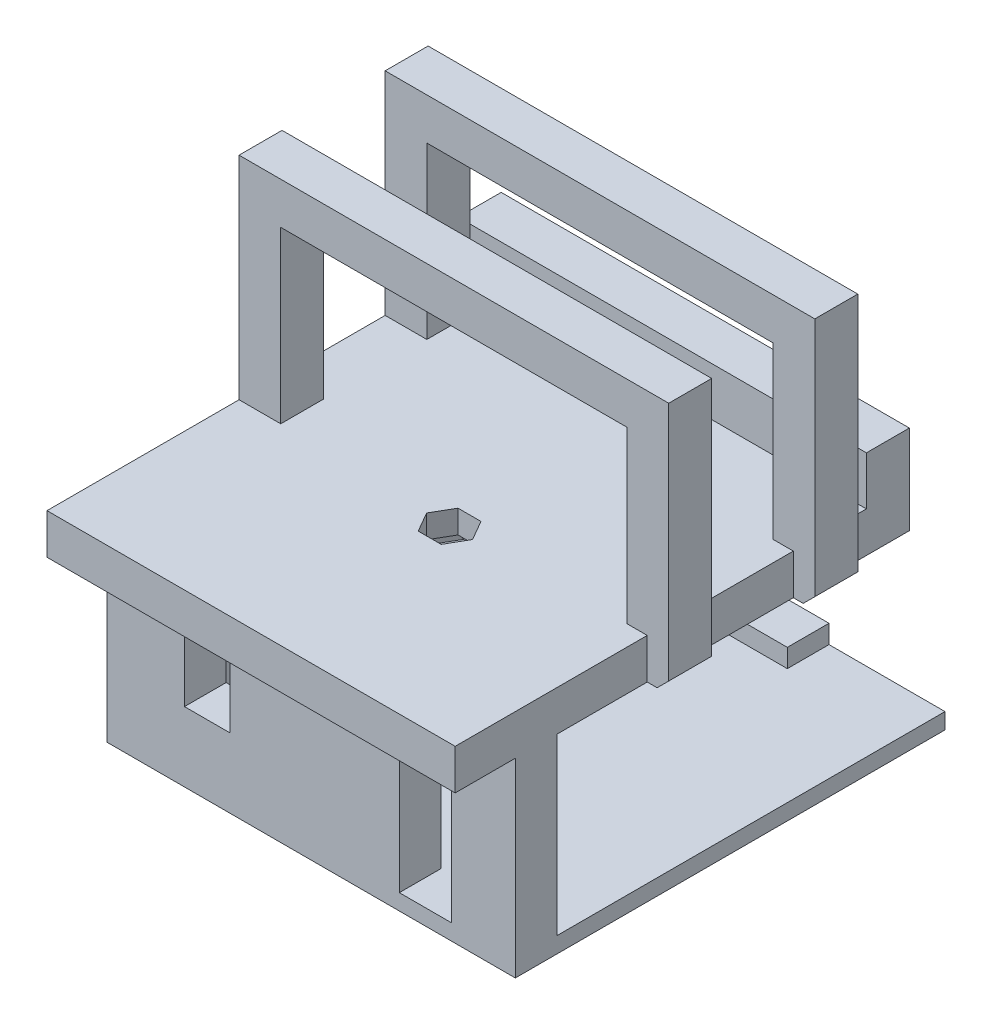
from build123d import *

# Parameters (mm, degrees)
MAIN_BODY_EXTRUDE_DEPTH            = 25
SKETCH2_W                          = 40
SKETCH2_H                          = 19.5
SKETCH2_W_2                        = 5.75
SKETCH2_H_2                        = 20
CUT_OUT_FOR_SERVO_AND_CAMERA_DEPTH = 69.448886039
CUT_EXTRUDE2_DEPTH                 = 5
CUT_EXTRUDE3_START                 = -5
CUT_EXTRUDE3_DEPTH                 = 2
MOVE_FACE1_BY                      = 2
SKETCH6_W                          = 5
SKETCH6_H                          = 7.5
CABLE_CLEARANCE_DEPTH              = 5
SKETCH7_W                          = 5
SKETCH7_H                          = 5.5
BOSS_EXTRUDE1_DEPTH                = 50
SKETCH8_R                          = 5
BOSS_EXTRUDE2_DEPTH                = 5
SKETCH8_3_R                        = 5
BOSS_EXTRUDE3_DEPTH                = 5
BOSS_EXTRUDE3_TAPER                = 10
SKETCH9_W                          = 25.15
SKETCH9_H                          = 2
BOSS_EXTRUDE4_DEPTH                = 5
INSET_THE_WALL_DEPTH               = 2.5
FRAME_CHAMFER_1_DEPTH              = 5
FRAME_START                        = -17
FRAME_CHAMFER_2_DEPTH              = 5
SKETCH12_W                         = 47.5
SKETCH12_H                         = 5
BOSS_EXTRUDE7_DEPTH                = 7
OFFSET_START                       = -5
OFFSET_FOR_3D_PRINT_OUTLINE_W      = 13
OFFSET_FOR_3D_PRINT_OUTLINE_H      = 0.15
OFFSET_FOR_3D_PRINT_DEPTH          = 14.85
OFFSET_FOR_3D_PRINT_2_OUTLINE_W    = 13
OFFSET_FOR_3D_PRINT_2_OUTLINE_H    = 19.7
OFFSET_FOR_3D_PRINT_2_DEPTH        = 0.15
OFFSET_START_2                     = 9.7
OFFSET_FOR_3D_PRINT_3_OUTLINE_W    = 13
OFFSET_FOR_3D_PRINT_3_OUTLINE_H    = 19.7
OFFSET_FOR_3D_PRINT_3_DEPTH        = 0.15
OFFSET_START_3                     = -10.15
OFFSET_FOR_3D_PRINT_5_DEPTH        = 20.3
OFFSET_START_4                     = 14.85
OFFSET_FOR_3D_PRINT_6_DEPTH        = 19.8
OFFSET_START_5                     = 10
OFFSET_FOR_3D_PRINT_7_DEPTH        = 0.15
OFFSET_START_6                     = -3.9
OFFSET_FOR_3D_PRINT_8_OUTLINE_W    = 5.3
OFFSET_FOR_3D_PRINT_8_OUTLINE_H    = 4.85
OFFSET_FOR_3D_PRINT_8_DEPTH        = 7.8
OFFSET_START_7                     = 10.15
OFFSET_FOR_3D_PRINT_9_DEPTH        = 2
OFFSET_START_8                     = 12.15
OFFSET_FOR_3D_PRINT_10_DEPTH       = 2.7


with BuildPart() as part:
    # Sketch1 → Main Body Extrude (new, symmetric)
    with BuildSketch(Plane(origin=(0, 0, 0), x_dir=(0, 0, -1), z_dir=(1, 0, 0))):
        Polygon((-14.85, -12), (35.15, -12), (35.15, -8), (30.15, -8), (30.15, -10), (-9.85, -10), (-9.85, 10), (22.5, 10), (22.5, 39.5), (17.5, 39.5), (17.5, 15), (5.5, 15), (5.5, 39.5), (0.5, 39.5), (0.5, 15), (-14.85, 15), align=None)
    extrude(amount=MAIN_BODY_EXTRUDE_DEPTH, both=True)

    # Sketch2 → Cut out for Servo and camera (cut, through all)
    with BuildSketch(Plane.XY.offset(14.85)):
        with Locations((0, 24.75)):
            Rectangle(SKETCH2_W, SKETCH2_H)
        with Locations((12.025, 0)):
            Rectangle(SKETCH2_W_2, SKETCH2_H_2)
    extrude(amount=-CUT_OUT_FOR_SERVO_AND_CAMERA_DEPTH, mode=Mode.SUBTRACT)

    # Sketch3 → Cut-Extrude2 (cut)
    with BuildSketch(Plane(origin=(0, 15, 0), x_dir=(1, 0, 0), z_dir=(0, 1, 0))):
        Polygon((2.5, 0), (1.25, 2.165063509), (-1.25, 2.165063509), (-2.5, 0), (-1.25, -2.165063509), (1.25, -2.165063509), align=None)
    extrude(amount=-CUT_EXTRUDE2_DEPTH, mode=Mode.SUBTRACT)

    # Sketch3<3> → Cut-Extrude3 (cut)
    with BuildSketch(Plane(origin=(0, 15, 0), x_dir=(1, 0, 0), z_dir=(0, 1, 0)).offset(CUT_EXTRUDE3_START)):
        Polygon((4.809401077, 0), (2.404700538, 4.165063509), (-2.404700538, 4.165063509), (-4.809401077, 0), (-2.404700538, -4.165063509), (2.404700538, -4.165063509), align=None)
    extrude(amount=CUT_EXTRUDE3_DEPTH, mode=Mode.SUBTRACT)

    # Move Face1: a face moved inward by 2.0
    extrude(part.faces().sort_by_distance((19.95, -8, -32.65))[0], amount=MOVE_FACE1_BY, dir=(0, -1, 0), mode=Mode.SUBTRACT)

    # Sketch6 → Cable Clearance (cut)
    with BuildSketch(Plane.XY.offset(14.85)):
        with Locations((-13.35, 0)):
            Rectangle(SKETCH6_W, SKETCH6_H)
    extrude(amount=-CABLE_CLEARANCE_DEPTH, mode=Mode.SUBTRACT)

    # Sketch7 → Boss-Extrude1 (add)
    with BuildSketch(Plane(origin=(25, 0, 0), x_dir=(0, 0, -1), z_dir=(1, 0, 0))):
        Polygon((22.5, 15), (22.5, 10), (31, 10), (31, 15), (26, 15), align=None)
        with Locations((28.5, 17.75)):
            Rectangle(SKETCH7_W, SKETCH7_H)
    extrude(amount=-BOSS_EXTRUDE1_DEPTH)

    # Sketch9 → Boss-Extrude4 (add)
    with BuildSketch(Plane.ZY.offset(25)):
        with Locations((-17.575, -9)):
            Rectangle(SKETCH9_W, SKETCH9_H)
    extrude(amount=-BOSS_EXTRUDE4_DEPTH)

    # Sketch10 → Inset the wall (cut)
    with BuildSketch(Plane(origin=(25, 0, 0), x_dir=(0, 0, -1), z_dir=(1, 0, 0))):
        Polygon((0.5, 15), (5.5, 15), (17.5, 15), (22.5, 15), (26, 15), (26, 20.5), (31, 20.5), (31, 10), (-9.85, 10), (-9.85, -10), (35.15, -10), (35.15, -12), (-14.85, -12), (-14.85, 15), align=None)
    extrude(amount=-INSET_THE_WALL_DEPTH, mode=Mode.SUBTRACT)

    # Sketch11 → Frame Chamfer 1 (add)
    with BuildSketch(Plane.XY.offset(-0.5)):
        Polygon((25, 11.5), (25, 15), (22.5, 15), (22.5, 10), (23.5, 10), align=None)
    extrude(amount=-FRAME_CHAMFER_1_DEPTH)

    # Sketch11<3> → Frame Chamfer 2 (add)
    with BuildSketch(Plane.XY.offset(-0.5).offset(FRAME_START)):
        Polygon((25, 11.5), (25, 15), (22.5, 15), (22.5, 10), (23.5, 10), align=None)
    extrude(amount=-FRAME_CHAMFER_2_DEPTH)

    # Sketch12 → Boss-Extrude7 (add)
    with BuildSketch(Plane.XY.offset(14.85)):
        with Locations((-1.25, 12.5)):
            Rectangle(SKETCH12_W, SKETCH12_H)
    extrude(amount=BOSS_EXTRUDE7_DEPTH)

    # Offset for 3D print 5 outline → Offset for 3D print 5 (cut)
    with BuildSketch(Plane(origin=(0, 0, 0), x_dir=(1, 0, 0), z_dir=(0, 1, 0)).offset(OFFSET_START_3)):
        Polygon((22.5, 0.5), (23.65, 0.5), (23.65, 5.5), (22.5, 5.5), (22.5, 17.5), (23.65, 17.5), (23.65, 22.5), (22.5, 22.5), (22.5, 35.15), (9, 35.15), (9, 30.3), (-20.15, 30.3), (-20.15, 5), (-25, 5), (-25, -10), (9, -10), (9, -14.85), (-25, -14.85), (-25, -21.85), (22.5, -21.85), (22.5, -14.85), (15.05, -14.85), (15.05, -10), (22.5, -10), align=None)
    extrude(amount=OFFSET_FOR_3D_PRINT_5_DEPTH, mode=Mode.SUBTRACT)

    # Offset for 3D print 6 outline → Offset for 3D print 6 (cut)
    with BuildSketch(Plane(origin=(0, 0, 0), x_dir=(1, 0, 0), z_dir=(0, 1, 0)).offset(OFFSET_START_4)):
        Polygon((-20.15, 0.5), (-25, 0.5), (-25, -21.85), (22.5, -21.85), (22.5, 0.5), (20.15, 0.5), (20.15, 5.5), (22.5, 5.5), (22.5, 17.5), (20.15, 17.5), (20.15, 22.5), (22.5, 22.5), (22.5, 26), (-25, 26), (-25, 22.5), (-20.15, 22.5), (-20.15, 17.5), (-25, 17.5), (-25, 5.5), (-20.15, 5.5), align=None)
        Polygon((-2.5, 0), (-2.211324865, 0.5), (2.211324865, 0.5), (2.5, 0), (1.25, -2.165063509), (-1.25, -2.165063509), align=None, mode=Mode.SUBTRACT)
    extrude(amount=OFFSET_FOR_3D_PRINT_6_DEPTH, mode=Mode.SUBTRACT)

    # Offset for 3D print 7 outline → Offset for 3D print 7 (cut)
    with BuildSketch(Plane(origin=(0, 0, 0), x_dir=(1, 0, 0), z_dir=(0, 1, 0)).offset(OFFSET_START_5)):
        Polygon((-25, 5), (-20.15, 5), (-20.15, 30.3), (9, 30.3), (9, 31), (-25, 31), align=None)
    extrude(amount=OFFSET_FOR_3D_PRINT_7_DEPTH, mode=Mode.SUBTRACT)

    # Offset for 3D print 8 outline → Offset for 3D print 8 (cut)
    with BuildSketch(Plane(origin=(0, 0, 0), x_dir=(1, 0, 0), z_dir=(0, 1, 0)).offset(OFFSET_START_6)):
        with Locations((-13.35, -12.425)):
            Rectangle(OFFSET_FOR_3D_PRINT_8_OUTLINE_W, OFFSET_FOR_3D_PRINT_8_OUTLINE_H)
    extrude(amount=OFFSET_FOR_3D_PRINT_8_DEPTH, mode=Mode.SUBTRACT)

    # Offset for 3D print 9 outline → Offset for 3D print 9 (cut)
    with BuildSketch(Plane(origin=(0, 0, 0), x_dir=(1, 0, 0), z_dir=(0, 1, 0)).offset(OFFSET_START_7)):
        Polygon((-4.982606158, 0), (-2.491303079, -4.315063509), (2.491303079, -4.315063509), (4.982606158, 0), (2.577905619, 4.165063509), (-2.577905619, 4.165063509), align=None)
        Polygon((-2.5, 0), (-1.25, 2.165063509), (1.25, 2.165063509), (2.5, 0), (1.25, -2.165063509), (-1.25, -2.165063509), align=None, mode=Mode.SUBTRACT)
    extrude(amount=OFFSET_FOR_3D_PRINT_9_DEPTH, mode=Mode.SUBTRACT)

    # Offset for 3D print 10 outline → Offset for 3D print 10 (cut)
    with BuildSketch(Plane(origin=(0, 0, 0), x_dir=(1, 0, 0), z_dir=(0, 1, 0)).offset(OFFSET_START_8)):
        Polygon((2.673205081, 0), (1.33660254, 2.315063509), (-1.33660254, 2.315063509), (-2.673205081, 0), (-1.33660254, -2.315063509), (1.33660254, -2.315063509), align=None)
        Polygon((-2.5, 0), (-1.25, 2.165063509), (1.25, 2.165063509), (2.5, 0), (1.25, -2.165063509), (-1.25, -2.165063509), align=None, mode=Mode.SUBTRACT)
    extrude(amount=OFFSET_FOR_3D_PRINT_10_DEPTH, mode=Mode.SUBTRACT)


with BuildPart() as body_2:
    # Sketch8 → Boss-Extrude2 (new body)
    # profile 1 of 2: a face of its own
    with BuildSketch(Plane.ZY.offset(25)):
        Polygon((9.85, -10), (9.85, 10), (-5, 10), (-5, 7e-09), (-5, -10), align=None)
        with BuildLine():
            ThreePointArc((5, 0), (-4e-09, -5), (-5, 7e-09))
            ThreePointArc((-5, 7e-09), (4e-09, 5), (5, 0))
        make_face(mode=Mode.SUBTRACT)
    # profile 2 of 2: a face of its own
    with BuildSketch(Plane.ZY.offset(25)):
        Circle(SKETCH8_R)
    extrude(amount=-BOSS_EXTRUDE2_DEPTH)

    # Sketch8<3> → Boss-Extrude3 (add)
    with BuildSketch(Plane.ZY.offset(25)):
        Circle(SKETCH8_3_R)
    extrude(amount=BOSS_EXTRUDE3_DEPTH, taper=BOSS_EXTRUDE3_TAPER)

    # Offset for 3D print: read off the stored shape, not the designer's step
    # Offset for 3D print outline → Offset for 3D print (cut)
    with BuildSketch(Plane.XY.offset(OFFSET_START)):
        with Locations((-25.5, 9.925)):
            Rectangle(OFFSET_FOR_3D_PRINT_OUTLINE_W, OFFSET_FOR_3D_PRINT_OUTLINE_H)
        with Locations((-25.5, -9.925)):
            Rectangle(OFFSET_FOR_3D_PRINT_OUTLINE_W, OFFSET_FOR_3D_PRINT_OUTLINE_H)
    extrude(amount=OFFSET_FOR_3D_PRINT_DEPTH, mode=Mode.SUBTRACT)

    # Offset for 3D print 2 outline → Offset for 3D print 2 (cut)
    with BuildSketch(Plane.XY.offset(OFFSET_START)):
        with Locations((-25.5, 0)):
            Rectangle(OFFSET_FOR_3D_PRINT_2_OUTLINE_W, OFFSET_FOR_3D_PRINT_2_OUTLINE_H)
    extrude(amount=OFFSET_FOR_3D_PRINT_2_DEPTH, mode=Mode.SUBTRACT)

    # Offset for 3D print 3 outline → Offset for 3D print 3 (cut)
    with BuildSketch(Plane.XY.offset(OFFSET_START_2)):
        with Locations((-25.5, 0)):
            Rectangle(OFFSET_FOR_3D_PRINT_3_OUTLINE_W, OFFSET_FOR_3D_PRINT_3_OUTLINE_H)
    extrude(amount=OFFSET_FOR_3D_PRINT_3_DEPTH, mode=Mode.SUBTRACT)

    # Offset for 3D print 4 outline → Offset for 3D print 4 (revolve, cut)
    with BuildSketch(Plane.YX):
        Polygon((3.966051105, -30), (4.118365096, -30), (5, -25), (4.847686008, -25), align=None)
    revolve(axis=Axis((0, 0, 0), (1, 0, 0)), mode=Mode.SUBTRACT)


solid = Compound([part.part, body_2.part])
